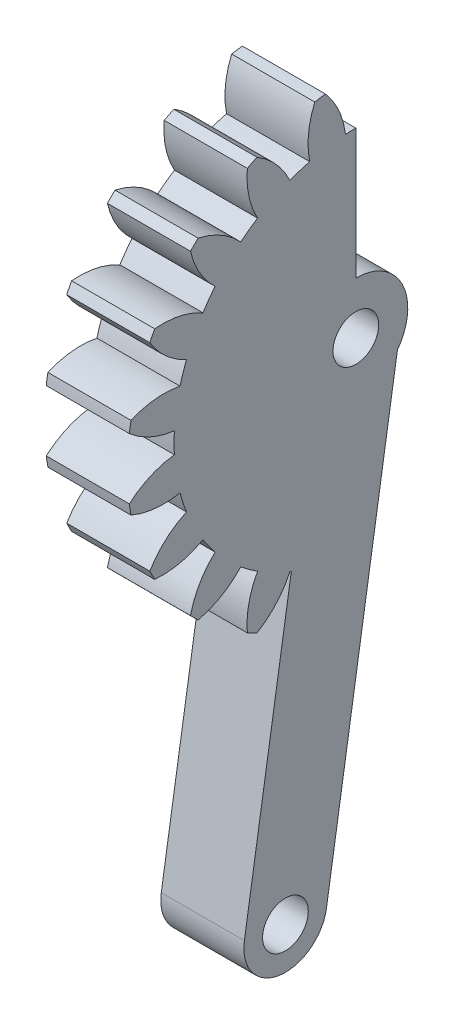
from build123d import *

# Parameters (mm, degrees)
BASPROSKE_W         = 4
BASPROSKE_H         = 11
TOOTHCUT_DEPTH      = 17.062378404
TEETHCUTS_COUNT     = 20
TEETHCUTS_ANGLE     = 342
BORSKE_R            = 1.1
BORE_DEPTH          = 50.0000508
CUT_EXTRUDE_1_DEPTH = 10
EXTRUDE_1_REACH     = 38.494
SKETCH_6_W          = 4
SKETCH_6_H          = 4
FILLET_1_R          = 2
SKETCH_7_R          = 1.1
CUT_EXTRUDE_2_DEPTH = 10


with BuildPart() as part:
    # BasProSke → Base-Revolve (revolve)
    with BuildSketch(Plane(origin=(0, 0, 0), x_dir=(1, 0, 0), z_dir=(0, 1, 0)), mode=Mode.PRIVATE) as base_revolve_sk:
        with Locations((2, 5.5)):
            Rectangle(BASPROSKE_W, BASPROSKE_H)
    revolve(base_revolve_sk.sketch.rotate(Axis((-10, 0, 0), (1, 0, 0)), 180), axis=Axis((-10, 0, 0), (1, 0, 0)))

    # TooCutSke → ToothCut (cut, through all)
    with BuildSketch(Plane(origin=(0, 0, 0), x_dir=(0, 0, -1), z_dir=(1, 0, 0))):
        with BuildLine():
            ThreePointArc((0.499924007, 8.734705318), (0, 8.749), (-0.499924007, 8.734705318))
            ThreePointArc((-0.499924007, 8.734705318), (-0.824302243, 9.905497836), (-1.485192705, 10.924909509))
            ThreePointArc((-1.485192705, 10.924909509), (0, 11.0254), (1.485192705, 10.924909509))
            ThreePointArc((1.485192705, 10.924909509), (0.824302243, 9.905497836), (0.499924007, 8.734705318))
        make_face()
    toothcut = extrude(amount=TOOTHCUT_DEPTH, mode=Mode.SUBTRACT)

    # TeethCuts: ToothCut ×20 about axis
    teethcuts_axis = Axis((-10, 0, 0), (1, 0, 0))
    for i in range(1, TEETHCUTS_COUNT):
        add(toothcut.rotate(teethcuts_axis, i * TEETHCUTS_ANGLE / (TEETHCUTS_COUNT - 1)), mode=Mode.SUBTRACT)

    # BorSke → Bore (cut, symmetric)
    with BuildSketch(Plane(origin=(0, 0, 0), x_dir=(0, 0, -1), z_dir=(1, 0, 0))):
        with Locations(Location((0, 0, 0), (0, 0, 180))):
            Circle(BORSKE_R)
    extrude(amount=BORE_DEPTH, both=True, mode=Mode.SUBTRACT)

    # 草图1 → 切除-拉伸1 (cut)
    with BuildSketch(Plane(origin=(4, 0, 0), x_dir=(0, 0, -1), z_dir=(1, 0, 0))):
        with BuildLine():
            Line((0, 12.401538845), (0, 2.5))
            ThreePointArc((0, 2.5), (1.767766953, 1.767766953), (2.5, 0))
            ThreePointArc((2.5, 0), (1.767766953, -1.767766953), (0, -2.5))
            Line((0, -2.5), (0, -15.030002789))
            Line((0, -15.030002789), (15.193341894, -15.030002789))
            Line((15.193341894, -15.030002789), (15.193341894, 12.401538845))
            Line((15.193341894, 12.401538845), (0, 12.401538845))
        make_face()
    extrude(amount=-CUT_EXTRUDE_1_DEPTH, mode=Mode.SUBTRACT)

    # 草图6 → 凸台-拉伸1 (add, up to next)
    with BuildSketch(Plane(origin=(0, -24.692208515, 3.910861626), x_dir=(0, -0.1564344650402271, -0.9876883405951383), z_dir=(0, -0.9876883405951383, 0.1564344650402271)), mode=Mode.PRIVATE) as extrude_1_sk1:
        with Locations((0.210861626, 2)):
            Rectangle(SKETCH_6_W, SKETCH_6_H)
    extrude_1_tool1 = extrude(extrude_1_sk1.sketch, amount=-EXTRUDE_1_REACH, mode=Mode.PRIVATE) - part.part
    add(extrude_1_tool1.solids().sort_by_distance((2, -24.725195, 3.702596))[0])

    # 圆角1
    fillet_1_edges = [part.edges().sort_by_distance(p)[0] for p in [
        (2, -24.41232561, 5.677972738),
        (2, -25.038063471, 1.727219375),
    ]]
    fillet(fillet_1_edges, radius=FILLET_1_R - 0.0001)  # a hair under: the kernel refuses the full size

    # 草图7 → 切除-拉伸2 (cut)
    with BuildSketch(Plane(origin=(4, 0, 0), x_dir=(0, 0, -1), z_dir=(1, 0, 0))):
        with Locations((-3.389727126, -22.749817859)):
            Circle(SKETCH_7_R)
    extrude(amount=-CUT_EXTRUDE_2_DEPTH, mode=Mode.SUBTRACT)


solid = part.part
